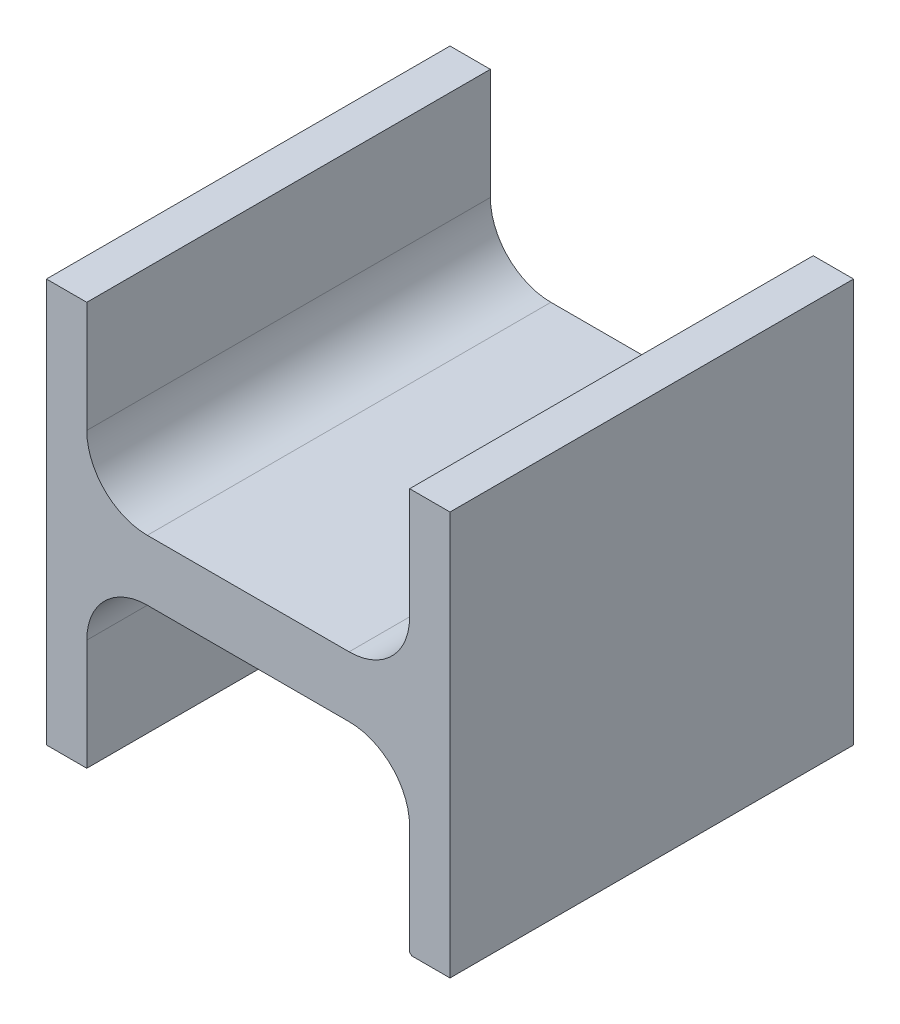
from build123d import *

# Parameters (mm, degrees)
BOSS_EXTRUDE2_DEPTH = 20
FILLET1_R           = 3
FILLET2_R           = 3
CUT_EXTRUDE1_DEPTH  = 25.494897428


with BuildPart() as part:
    # Sketch2 → Boss-Extrude2 (new body)
    with BuildSketch(Plane.XY):
        Polygon((-10, -10), (-8, -10), (-8, -1.5), (8, -1.5), (8, -10), (10, -10), (10, 10), (8, 10), (8, 1.5), (-8, 1.5), (-8, 10), (-10, 10), align=None)
    extrude(amount=BOSS_EXTRUDE2_DEPTH)

    # Fillet1
    fillet1_edges = [part.edges().sort_by_distance(p)[0] for p in [
        (-8, 1.5, 10),
    ]]
    fillet(fillet1_edges, radius=FILLET1_R)

    # Fillet2
    fillet2_edges = [part.edges().sort_by_distance(p)[0] for p in [
        (-8, -1.5, 10),
        (8, -1.5, 10),
        (8, 1.5, 10),
    ]]
    fillet(fillet2_edges, radius=FILLET2_R)

    # Sketch3 → Cut-Extrude1 (cut, through all)
    with BuildSketch(Plane.XY.offset(20)):
        Polygon((8, -10), (8.103608958, -10), (8, -9.896391042), align=None)
    extrude(amount=-CUT_EXTRUDE1_DEPTH, mode=Mode.SUBTRACT)


solid = part.part
